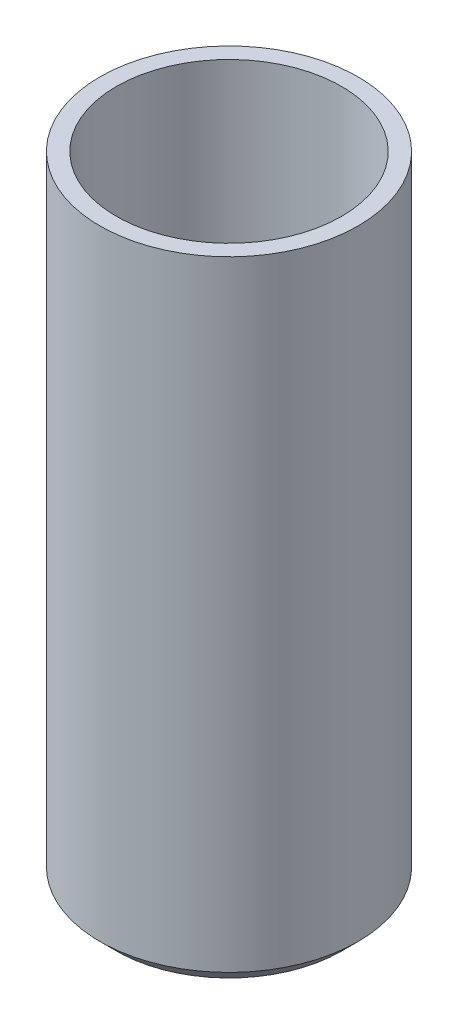
from build123d import *


with BuildPart() as part:
    # Sketch1 → Revolve1 (revolve)
    with BuildSketch(Plane.XY):
        Polygon((0, 0), (-5.11862915, 0), (-5.45, 0.33137085), (-5.45, 30), (-6.25, 30), (-6.25, 0), (-5.45, -0.8), (0, -0.8), align=None)
    revolve(axis=Axis((0, -549.903747034, 0), (0, 1, 0)))


solid = part.part
